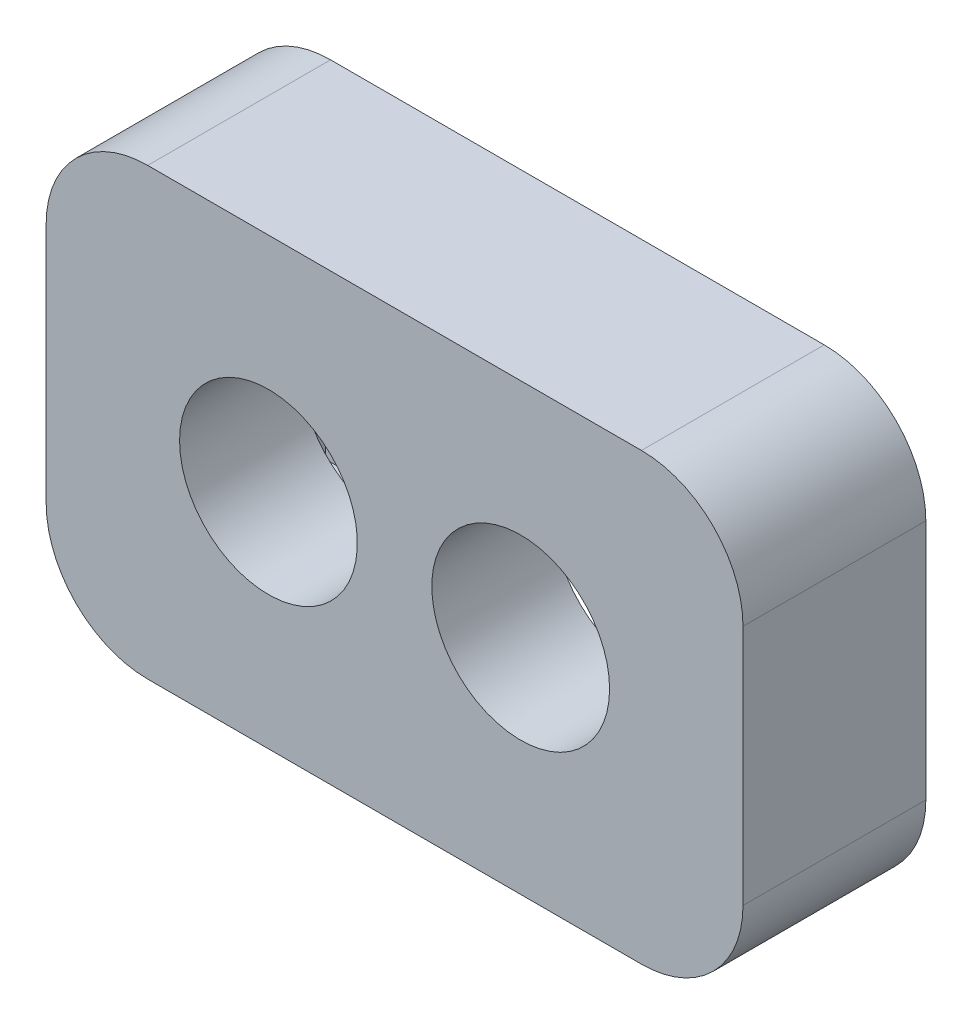
from build123d import *

# Parameters (mm, degrees)
SKETCH1_W           = 68.6
SKETCH1_H           = 43.8
SKETCH1_R           = 8.75
BOSS_EXTRUDE1_DEPTH = 12
CUT_EXTRUDE1_DEPTH  = 3.35
SKETCH3_W           = 68.6
SKETCH3_H           = 43.8
SKETCH3_W_2         = 45.6
SKETCH3_H_2         = 20.8
BOSS_EXTRUDE2_DEPTH = 6
FILLET1_R           = 10
SKETCH4_R           = 5.2
CUT_EXTRUDE2_DEPTH  = 2.3
BOSS_EXTRUDE6_DEPTH = 2
FILLET2_R           = 3
FILLET3_R           = 1
SKETCH7_W           = 14.55
SKETCH7_H           = 11.5
CUT_EXTRUDE3_DEPTH  = 5


with BuildPart() as part:
    # Sketch1 → Boss-Extrude1 (new body)
    with BuildSketch(Plane.XY):
        Rectangle(SKETCH1_W, SKETCH1_H)
        with Locations((12.415962636, 0)):
            Circle(SKETCH1_R, mode=Mode.SUBTRACT)
        with Locations(Location((-12.415962636, 0, 0), (0, 0, 180))):
            Circle(SKETCH1_R, mode=Mode.SUBTRACT)
    extrude(amount=BOSS_EXTRUDE1_DEPTH)

    # Sketch2 → Cut-Extrude1 (cut)
    with BuildSketch(Plane(origin=(0, 0, 0), x_dir=(-1, 0, 0), z_dir=(0, 0, -1))):
        with BuildLine():
            Line((3.175, 6), (-3.175, 6))
            ThreePointArc((-3.175, 6), (-5.3, 8.125), (-3.175, 10.25))
            Line((-3.175, 10.25), (3.175, 10.25))
            ThreePointArc((3.175, 10.25), (5.3, 8.125), (3.175, 6))
        make_face()
    extrude(amount=-CUT_EXTRUDE1_DEPTH, mode=Mode.SUBTRACT)

    # Sketch3 → Boss-Extrude2 (add)
    with BuildSketch(Plane(origin=(0, 0, 0), x_dir=(-1, 0, 0), z_dir=(0, 0, -1))):
        Rectangle(SKETCH3_W, SKETCH3_H)
        Rectangle(SKETCH3_W_2, SKETCH3_H_2, mode=Mode.SUBTRACT)
    extrude(amount=BOSS_EXTRUDE2_DEPTH)

    # Fillet1
    fillet1_edges = [part.edges().sort_by_distance(p)[0] for p in [
        (34.3, -21.9, 3),
        (-34.3, -21.9, 3),
        (-34.3, 21.9, 3),
        (34.3, 21.9, 3),
    ]]
    fillet(fillet1_edges, radius=FILLET1_R)

    # Sketch4 → Cut-Extrude2 (cut)
    with BuildSketch(Plane(origin=(0, 0, -6), x_dir=(-1, 0, 0), z_dir=(0, 0, -1))):
        with Locations((27, 14.6)):
            Circle(SKETCH4_R)
        with Locations(Location((-27, 14.6, 0), (0, 0, 180))):
            Circle(SKETCH4_R)
        with Locations(Location((27, -14.6, 0), (0, 0, 180))):
            Circle(SKETCH4_R)
        with Locations((-27, -14.6)):
            Circle(SKETCH4_R)
    extrude(amount=-CUT_EXTRUDE2_DEPTH, mode=Mode.SUBTRACT)

    # Sketch6 → Boss-Extrude6 (add)
    with BuildSketch(Plane(origin=(0, 0, -6), x_dir=(-1, 0, 0), z_dir=(0, 0, -1))):
        Polygon((-22.8, -10.4), (-7.275, -10.4), (-7.275, -9.4), (-21.8, -9.4), (-21.8, 9.4), (21.8, 9.4), (21.8, -9.4), (7.275, -9.4), (7.275, -10.4), (22.8, -10.4), (22.8, 10.4), (-22.8, 10.4), align=None)
    extrude(amount=-BOSS_EXTRUDE6_DEPTH)

    # Fillet2
    fillet2_edges = [part.edges().sort_by_distance(p)[0] for p in [
        (-21.8, -9.4, -5),
        (-21.8, 9.4, -5),
        (21.8, 9.4, -5),
        (21.8, -9.4, -5),
    ]]
    fillet(fillet2_edges, radius=FILLET2_R)

    # Fillet3
    fillet3_edges = [part.edges().sort_by_distance(p)[0] for p in [
        (13.0375, -9.4, -4),
        (20.921320344, -8.521320344, -4),
        (21.8, 0, -4),
        (20.921320344, 8.521320344, -4),
        (0, 9.4, -4),
        (-20.921320344, 8.521320344, -4),
        (-13.0375, -9.4, -4),
        (-20.921320344, -8.521320344, -4),
        (-21.8, 0, -4),
    ]]
    fillet(fillet3_edges, radius=FILLET3_R - 0.0001)  # a hair under: the kernel refuses the full size

    # Sketch7 → Cut-Extrude3 (cut)
    with BuildSketch(Plane(origin=(0, 0, -6), x_dir=(-1, 0, 0), z_dir=(0, 0, -1))):
        with Locations((0, -16.15)):
            Rectangle(SKETCH7_W, SKETCH7_H)
    extrude(amount=-CUT_EXTRUDE3_DEPTH, mode=Mode.SUBTRACT)


solid = part.part
